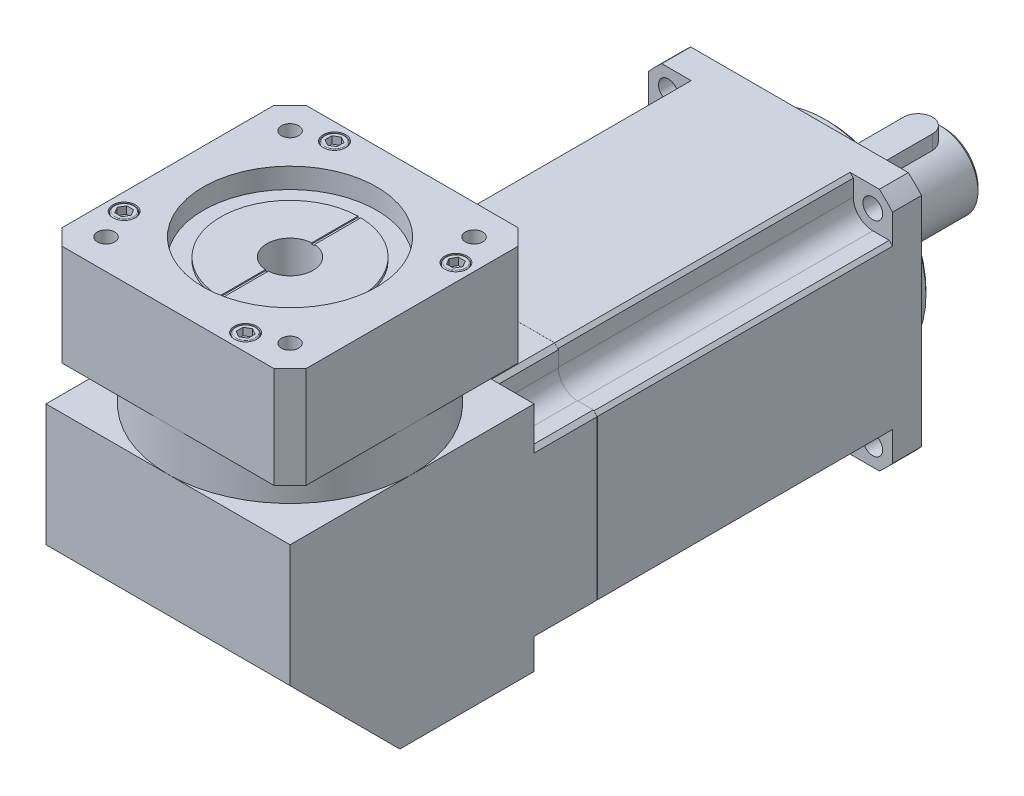
from build123d import *

# Parameters (mm, degrees)
EXTRUDE_START                    = 2
EXTRUDE_1_DEPTH                  = 6.5
CHAMFER_1_SIZE                   = 0.63
EXTRUDE_START_2                  = -88.1
EXTRUDE_2_DEPTH                  = 67
SKETCH_7_R                       = 1.7
CUT_EXTRUDE_1_DEPTH              = 5
CUT_EXTRUDE_START                = -83.1
CUT_EXTRUDE_2_DEPTH              = 62
CUT_EXTRUDE_8_DEPTH              = 1.428
SKETCH_20_R                      = 2.19
SKETCH_20_R_2                    = 2.04
CUT_EXTRUDE_9_DEPTH              = 2.448
FILLET_2_R                       = 0.204
CUT_EXTRUDE_18_DEPTH             = 51.08
PATTERN_CIRCULAR_1_COUNT         = 4
FILLET_2_OF_PATTERN_CIRCULAR_1_R = 0.204
EXTRUDE_START_3                  = -21.1
EXTRUDE_3_DEPTH                  = 42.2
CHAMFER_START                    = -83.1
CHAMFER_2_DEPTH                  = 62
CUT_EXTRUDE_3_REACH              = 98.718
SKETCH_12_R                      = 21.1
EXTRUDE_4_DEPTH                  = 7.5
EXTRUDE_START_4                  = 28.6
SKETCH_13_W                      = 42.2
SKETCH_13_H                      = 42.2
EXTRUDE_5_DEPTH                  = 17.5
SKETCH_15_R                      = 1.5
CUT_EXTRUDE_4_DEPTH              = 6
CUT_EXTRUDE_5_DEPTH              = 1.26
SKETCH_17_R                      = 1.95
SKETCH_17_R_2                    = 1.8
CUT_EXTRUDE_6_DEPTH              = 2.16
FILLET_1_R                       = 0.18
CUT_EXTRUDE_7_DEPTH              = 17.5
PATTERN_CIRCULAR_2_COUNT         = 4
FILLET_1_OF_PATTERN_CIRCULAR_2_R = 0.18
CUT_EXTRUDE_START_2              = -0.5
SKETCH_21_R                      = 15
SKETCH_21_R_2                    = 12
CUT_EXTRUDE_10_DEPTH             = 0.5
SKETCH_22_W                      = 0.5
SKETCH_22_H                      = 24
CUT_EXTRUDE_16_DEPTH             = 0.2
SKETCH_23_W                      = 42.2
SKETCH_23_H                      = 0.01
CUT_EXTRUDE_17_DEPTH             = 42.2
SKETCH_24_R                      = 10.692
SKETCH_24_R_2                    = 8.91
EXTRUDE_6_DEPTH                  = 0.1


with BuildPart() as part:
    # 草图4 → 旋转1 (revolve)
    with BuildSketch(Plane(origin=(0, 0, 0), x_dir=(0, 0, -1), z_dir=(1, 0, 0)), mode=Mode.PRIVATE) as revolve_1_sk:
        Polygon((113.1, 2), (113.1, 6.5), (94.1, 6.5), (94.1, 8.91), (93.1, 8.91), (93.1, 17.5), (88.1, 17.5), (88.1, 0), (103.945299462, 0), (105.1, 2), align=None)
    revolve(revolve_1_sk.sketch.rotate(Axis((0, 0, -88.1), (0, 0, -1)), 90), axis=Axis((0, 0, -88.1), (0, 0, -1)))

    # 草图5 → 凸台-拉伸1 (add)
    with BuildSketch(Plane(origin=(0, 0, 0), x_dir=(1, 0, 0), z_dir=(0, 1, 0)).offset(EXTRUDE_START)):
        with BuildLine():
            Line((-2.5, 108.6), (-2.5, 97.6))
            ThreePointArc((-2.5, 97.6), (0, 95.1), (2.5, 97.6))
            Line((2.5, 97.6), (2.5, 108.6))
            ThreePointArc((2.5, 108.6), (0, 111.1), (-2.5, 108.6))
        make_face()
    extrude(amount=EXTRUDE_1_DEPTH)

    # 倒角1
    chamfer_1_edges = [part.edges().sort_by_distance(p)[0] for p in [
        (-6.5, 0, -113.1),
        (-8.91, 0, -94.1),
        (-17.5, 0, -93.1),
    ]]
    chamfer(chamfer_1_edges, length=CHAMFER_1_SIZE)

    # 草图6 → 凸台-拉伸2 (add)
    with BuildSketch(Plane.XY.offset(EXTRUDE_START_2)):
        with BuildLine():
            Line((-18.814362793, 21.1), (18.814362793, 21.1))
            ThreePointArc((18.814362793, 21.1), (19.989875529, 19.989875529), (21.1, 18.814362793))
            Line((21.1, 18.814362793), (21.1, -18.814362793))
            ThreePointArc((21.1, -18.814362793), (19.989875529, -19.989875529), (18.814362793, -21.1))
            Line((18.814362793, -21.1), (-18.814362793, -21.1))
            ThreePointArc((-18.814362793, -21.1), (-19.989875529, -19.989875529), (-21.1, -18.814362793))
            Line((-21.1, -18.814362793), (-21.1, 18.814362793))
            ThreePointArc((-21.1, 18.814362793), (-19.989875529, 19.989875529), (-18.814362793, 21.1))
        make_face()
    extrude(amount=EXTRUDE_2_DEPTH)

    # 草图7 → 切除-拉伸1 (cut)
    with BuildSketch(Plane(origin=(0, 0, -88.1), x_dir=(-1, 0, 0), z_dir=(0, 0, -1))):
        with Locations((17.67766953, 17.67766953)):
            Circle(SKETCH_7_R)
    cut_extrude_1 = extrude(amount=-CUT_EXTRUDE_1_DEPTH, mode=Mode.SUBTRACT)

    # 草图8 → 切除-拉伸2 (cut)
    with BuildSketch(Plane.XY.offset(CUT_EXTRUDE_START)):
        with BuildLine():
            Line((-17.67766953, 14.407716447), (-21.1, 14.407716447))
            Line((-21.1, 14.407716447), (-21.1, 21.1))
            Line((-21.1, 21.1), (-14.407716447, 21.1))
            Line((-14.407716447, 21.1), (-14.407716447, 17.67766953))
            ThreePointArc((-14.407716447, 17.67766953), (-15.36546353, 15.36546353), (-17.67766953, 14.407716447))
        make_face()
    cut_extrude_2 = extrude(amount=CUT_EXTRUDE_2_DEPTH, mode=Mode.SUBTRACT)

    # 草图19 → 切除-拉伸8 (cut)
    with BuildSketch(Plane(origin=(0, 0, -88.1), x_dir=(-1, 0, 0), z_dir=(0, 0, -1))):
        Polygon((11.545023458, 17.640978106), (10.185023458, 17.640978106), (9.505023458, 18.818772656), (10.185023458, 19.996567205), (11.545023458, 19.996567205), (12.225023458, 18.818772656), align=None)
    cut_extrude_8 = extrude(amount=-CUT_EXTRUDE_8_DEPTH, mode=Mode.SUBTRACT)

    # 草图20 → 切除-拉伸9 (cut)
    with BuildSketch(Plane(origin=(0, 0, -88.1), x_dir=(-1, 0, 0), z_dir=(0, 0, -1))):
        with Locations((10.865023458, 18.818772656)):
            Circle(SKETCH_20_R)
        with Locations((10.865023458, 18.818772656)):
            Circle(SKETCH_20_R_2, mode=Mode.SUBTRACT)
    cut_extrude_9 = extrude(amount=-CUT_EXTRUDE_9_DEPTH, mode=Mode.SUBTRACT)

    # 圆角2
    fillet_2_edges = [part.edges().sort_by_distance(p)[0] for p in [
        (-8.825023458, 18.818772656, -88.1),
    ]]
    fillet(fillet_2_edges, radius=FILLET_2_R)

    # 草图25 → 切除-拉伸18 (cut)
    with BuildSketch(Plane.XY.offset(-83.1)):
        with BuildLine():
            Line((-14.407716447, 17.67766953), (-14.407716447, 21.1))
            Line((-14.407716447, 21.1), (-14.307716447, 21.1))
            Line((-14.307716447, 21.1), (-14.307716447, 17.67766953))
            ThreePointArc((-14.307716447, 17.67766953), (-15.294752852, 15.294752852), (-17.67766953, 14.307716447))
            Line((-17.67766953, 14.307716447), (-21.1, 14.307716447))
            Line((-21.1, 14.307716447), (-21.1, 14.407716447))
            Line((-21.1, 14.407716447), (-17.67766953, 14.407716447))
            ThreePointArc((-17.67766953, 14.407716447), (-15.36546353, 15.36546353), (-14.407716447, 17.67766953))
        make_face()
    cut_extrude_18 = extrude(amount=CUT_EXTRUDE_18_DEPTH, mode=Mode.SUBTRACT)

    # 阵列(圆周)1: 切除-拉伸1, 切除-拉伸2, 切除-拉伸8, 切除-拉伸9, 切除-拉伸18 ×4 about axis
    pattern_circular_1_axis = Axis((0, 0, 0), (0, 0, 1))
    add([cut_extrude_1.rotate(pattern_circular_1_axis, i * 360 / PATTERN_CIRCULAR_1_COUNT) for i in range(1, PATTERN_CIRCULAR_1_COUNT)], mode=Mode.SUBTRACT)
    add([cut_extrude_2.rotate(pattern_circular_1_axis, i * 360 / PATTERN_CIRCULAR_1_COUNT) for i in range(1, PATTERN_CIRCULAR_1_COUNT)], mode=Mode.SUBTRACT)
    add([cut_extrude_8.rotate(pattern_circular_1_axis, i * 360 / PATTERN_CIRCULAR_1_COUNT) for i in range(1, PATTERN_CIRCULAR_1_COUNT)], mode=Mode.SUBTRACT)
    add([cut_extrude_9.rotate(pattern_circular_1_axis, i * 360 / PATTERN_CIRCULAR_1_COUNT) for i in range(1, PATTERN_CIRCULAR_1_COUNT)], mode=Mode.SUBTRACT)
    add([cut_extrude_18.rotate(pattern_circular_1_axis, i * 360 / PATTERN_CIRCULAR_1_COUNT) for i in range(1, PATTERN_CIRCULAR_1_COUNT)], mode=Mode.SUBTRACT)

    # 圆角2 of 阵列(圆周)1
    fillet_2_of_pattern_circular_1_edges = [part.edges().sort_by_distance(p)[0] for p in [
        (-18.818772656, -8.825023458, -88.1),
        (8.825023458, -18.818772656, -88.1),
        (18.818772656, 8.825023458, -88.1),
    ]]
    fillet(fillet_2_of_pattern_circular_1_edges, radius=FILLET_2_OF_PATTERN_CIRCULAR_1_R)

    # 草图9 → 凸台-拉伸3 (add)
    with BuildSketch(Plane(origin=(0, 0, 0), x_dir=(0, 0, -1), z_dir=(1, 0, 0)).offset(EXTRUDE_START_3)):
        Polygon((21.1, 21.1), (-21.1, 21.1), (-21.1, 0), (0, -21.1), (21.1, -21.1), align=None)
    extrude(amount=EXTRUDE_3_DEPTH)

    # 倒角2: read off the stored shape, not the designer's step
    # 倒角2 outline → 倒角2 (cut)
    with BuildSketch(Plane.XY.offset(CHAMFER_START)):
        Polygon((14.407716447, 20.42), (14.407716447, 21.1), (13.727716447, 21.1), align=None)
        Polygon((-13.727716447, 21.1), (-14.407716447, 21.1), (-14.407716447, 20.42), align=None)
        Polygon((21.1, 14.407716447), (20.42, 14.407716447), (21.1, 13.727716447), align=None)
        Polygon((21.1, -13.727716447), (20.42, -14.407716447), (21.1, -14.407716447), align=None)
        Polygon((-20.42, 14.407716447), (-21.1, 14.407716447), (-21.1, 13.727716447), align=None)
        Polygon((-21.1, -13.727716447), (-21.1, -14.407716447), (-20.42, -14.407716447), align=None)
        Polygon((14.407716447, -21.1), (14.407716447, -20.42), (13.727716447, -21.1), align=None)
        Polygon((-13.727716447, -21.1), (-14.407716447, -20.42), (-14.407716447, -21.1), align=None)
    extrude(amount=CHAMFER_2_DEPTH, mode=Mode.SUBTRACT)

    # 切除-拉伸3: up to this plane
    cut_extrude_3_end = Plane(origin=(21.1, 0, 21.1), z_dir=(0, 0.7071067811865516, -0.7071067811865436))
    # 草图10 → 切除-拉伸3 (cut, up to the surface)
    with BuildSketch(Plane(origin=(0, 0, -21.1), x_dir=(-1, 0, 0), z_dir=(0, 0, -1)), mode=Mode.PRIVATE) as cut_extrude_3_sk1:
        Polygon((21.1, -21.1), (21.1, -18.99), (18.99, -21.1), align=None)
    cut_extrude_3_tool1 = split(extrude(cut_extrude_3_sk1.sketch, amount=-CUT_EXTRUDE_3_REACH, mode=Mode.PRIVATE), bisect_by=cut_extrude_3_end, keep=Keep.BOTH, mode=Mode.PRIVATE)
    cut_extrude_3 = cut_extrude_3_tool1.solids().sort_by_distance((-20.396667, -20.396667, -21.1))[0]
    add(cut_extrude_3, mode=Mode.SUBTRACT)

    # 镜向1: 切除-拉伸3 across plane
    add(cut_extrude_3.mirror(Plane(origin=(0, 0, 0), x_dir=(0, 0, 1), z_dir=(1, 0, 0))), mode=Mode.SUBTRACT)

    # 草图12 → 凸台-拉伸4 (add)
    with BuildSketch(Plane(origin=(0, 21.1, 0), x_dir=(1, 0, 0), z_dir=(0, 1, 0))):
        with Locations(Location((0, 0, 0), (0, 0, 270))):
            Circle(SKETCH_12_R)
    extrude(amount=EXTRUDE_4_DEPTH)

    # 草图13 → 凸台-拉伸5 (add)
    with BuildSketch(Plane(origin=(0, 0, 0), x_dir=(1, 0, 0), z_dir=(0, 1, 0)).offset(EXTRUDE_START_4)):
        Rectangle(SKETCH_13_W, SKETCH_13_H)
    extrude(amount=EXTRUDE_5_DEPTH)

    # 草图14 → 切除-旋转1 (revolve, cut)
    with BuildSketch(Plane(origin=(0, 0, 0), x_dir=(0, 0, -1), z_dir=(1, 0, 0))):
        Polygon((-15, 46.1), (-15, 43.1), (-4, 43.1), (-4, 21.1), (0, 21.1), (0, 46.1), align=None)
    revolve(axis=Axis((0, 46.1, 0), (0, -1, 0)), mode=Mode.SUBTRACT)

    # 草图15 → 切除-拉伸4 (cut)
    with BuildSketch(Plane(origin=(0, 46.1, 0), x_dir=(1, 0, 0), z_dir=(0, 1, 0))):
        with Locations(Location((15.909902577, -15.909902577, 0), (0, 0, 270))):
            Circle(SKETCH_15_R)
    cut_extrude_4 = extrude(amount=-CUT_EXTRUDE_4_DEPTH, mode=Mode.SUBTRACT)

    # 草图16 → 切除-拉伸5 (cut)
    with BuildSketch(Plane(origin=(0, 46.1, 0), x_dir=(1, 0, 0), z_dir=(0, 1, 0))):
        Polygon((10.5, -16.986533479), (9.460769515, -17.586533479), (9.460769515, -18.786533479), (10.5, -19.386533479), (11.539230485, -18.786533479), (11.539230485, -17.586533479), align=None)
    cut_extrude_5 = extrude(amount=-CUT_EXTRUDE_5_DEPTH, mode=Mode.SUBTRACT)

    # 草图17 → 切除-拉伸6 (cut)
    with BuildSketch(Plane(origin=(0, 46.1, 0), x_dir=(1, 0, 0), z_dir=(0, 1, 0))):
        with Locations(Location((10.5, -18.186533479, 0), (0, 0, 270))):
            Circle(SKETCH_17_R)
        with Locations(Location((10.5, -18.186533479, 0), (0, 0, 270))):
            Circle(SKETCH_17_R_2, mode=Mode.SUBTRACT)
    cut_extrude_6 = extrude(amount=-CUT_EXTRUDE_6_DEPTH, mode=Mode.SUBTRACT)

    # 圆角1
    fillet_1_edges = [part.edges().sort_by_distance(p)[0] for p in [
        (10.5, 46.1, 16.386533479),
    ]]
    fillet(fillet_1_edges, radius=FILLET_1_R)

    # 草图18 → 切除-拉伸7 (cut)
    with BuildSketch(Plane(origin=(0, 46.1, 0), x_dir=(1, 0, 0), z_dir=(0, 1, 0))):
        Polygon((21.1, -18.347041832), (18.347041832, -21.1), (21.1, -21.1), align=None)
    cut_extrude_7 = extrude(amount=-CUT_EXTRUDE_7_DEPTH, mode=Mode.SUBTRACT)

    # 阵列(圆周)2: 切除-拉伸4, 切除-拉伸5, 切除-拉伸6, 切除-拉伸7 ×4 about axis
    pattern_circular_2_axis = Axis((0, 0, 0), (0, 1, 0))
    add([cut_extrude_4.rotate(pattern_circular_2_axis, i * 360 / PATTERN_CIRCULAR_2_COUNT) for i in range(1, PATTERN_CIRCULAR_2_COUNT)], mode=Mode.SUBTRACT)
    add([cut_extrude_5.rotate(pattern_circular_2_axis, i * 360 / PATTERN_CIRCULAR_2_COUNT) for i in range(1, PATTERN_CIRCULAR_2_COUNT)], mode=Mode.SUBTRACT)
    add([cut_extrude_6.rotate(pattern_circular_2_axis, i * 360 / PATTERN_CIRCULAR_2_COUNT) for i in range(1, PATTERN_CIRCULAR_2_COUNT)], mode=Mode.SUBTRACT)
    add([cut_extrude_7.rotate(pattern_circular_2_axis, i * 360 / PATTERN_CIRCULAR_2_COUNT) for i in range(1, PATTERN_CIRCULAR_2_COUNT)], mode=Mode.SUBTRACT)

    # 圆角1 of 阵列(圆周)2
    fillet_1_of_pattern_circular_2_edges = [part.edges().sort_by_distance(p)[0] for p in [
        (16.386533479, 46.1, -10.5),
        (-10.5, 46.1, -16.386533479),
        (-16.386533479, 46.1, 10.5),
    ]]
    fillet(fillet_1_of_pattern_circular_2_edges, radius=FILLET_1_OF_PATTERN_CIRCULAR_2_R)

    # 草图21 → 切除-拉伸10 (cut)
    with BuildSketch(Plane(origin=(0, 43.1, 0), x_dir=(1, 0, 0), z_dir=(0, 1, 0)).offset(CUT_EXTRUDE_START_2)):
        with Locations(Location((0, 0, 0), (0, 0, 270))):
            Circle(SKETCH_21_R)
        with Locations(Location((0, 0, 0), (0, 0, 270))):
            Circle(SKETCH_21_R_2, mode=Mode.SUBTRACT)
    extrude(amount=CUT_EXTRUDE_10_DEPTH, mode=Mode.SUBTRACT)

    # 草图22 → 切除-拉伸16 (cut)
    with BuildSketch(Plane(origin=(0, 43.1, 0), x_dir=(1, 0, 0), z_dir=(0, 1, 0))):
        Rectangle(SKETCH_22_W, SKETCH_22_H)
    extrude(amount=-CUT_EXTRUDE_16_DEPTH, mode=Mode.SUBTRACT)

    # 草图23 → 切除-拉伸17 (cut)
    with BuildSketch(Plane(origin=(0, 21.1, 0), x_dir=(1, 0, 0), z_dir=(0, 1, 0))):
        with Locations((0, 32.025)):
            Rectangle(SKETCH_23_W, SKETCH_23_H)
    extrude(amount=-CUT_EXTRUDE_17_DEPTH, mode=Mode.SUBTRACT)


with BuildPart() as cut_extrude_17_piece_1:
    # of the separate pieces the step leaves, piece 1, a body of its own (cut_extrude_17_pieces)
    add(part.part.solids().sort_by_distance((-19.986533479, 45.92, 10.5))[0])


with BuildPart() as cut_extrude_17_piece_2:
    # of the separate pieces the step leaves, piece 2, a body of its own (cut_extrude_17_pieces)
    add(part.part.solids().sort_by_distance((13.727716447, 21.1, -32.03))[0])

    # 草图24 → 凸台-拉伸6 (add)
    with BuildSketch(Plane(origin=(0, 0, -93.1), x_dir=(-1, 0, 0), z_dir=(0, 0, -1))):
        with Locations(Location((0, 0, 0), (0, 0, 180))):
            Circle(SKETCH_24_R)
        with Locations(Location((0, 0, 0), (0, 0, 180))):
            Circle(SKETCH_24_R_2, mode=Mode.SUBTRACT)
    extrude(amount=EXTRUDE_6_DEPTH)


solid = Compound([cut_extrude_17_piece_1.part, cut_extrude_17_piece_2.part])
